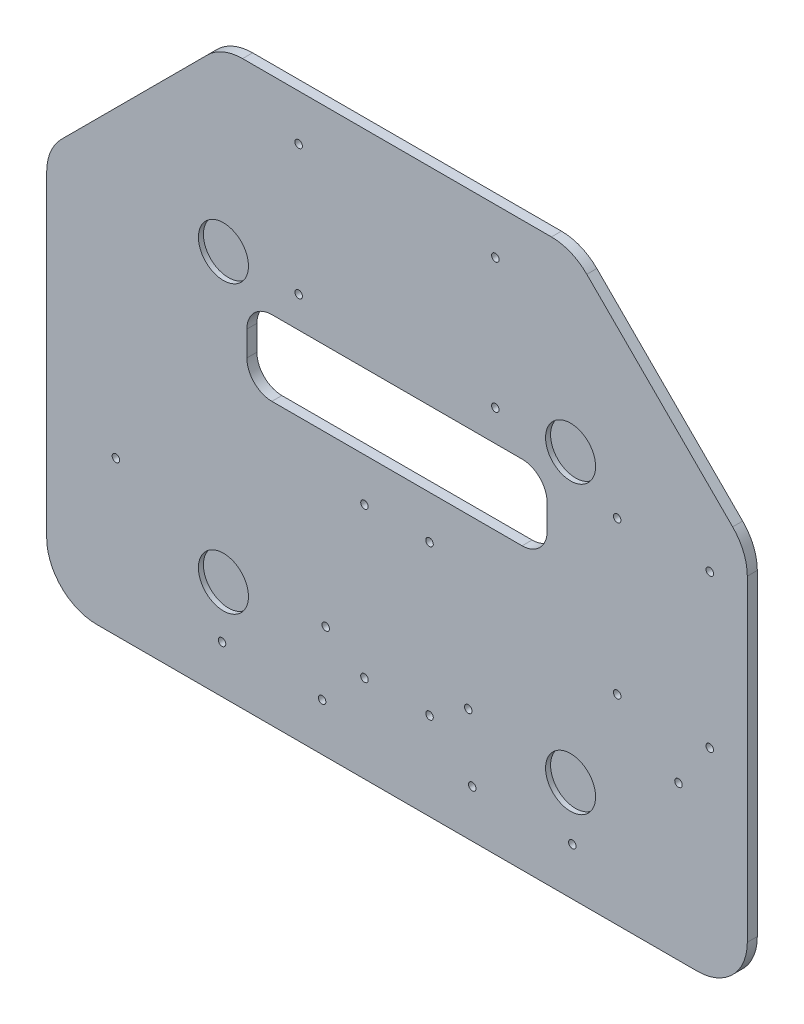
from build123d import *

# Parameters (mm, degrees)
EXTRUDE_1_DEPTH      = 4
SKETCH_6_R           = 1.5
CUT_EXTRUDE_3_DEPTH  = 4
SKETCH_4_R           = 1.5
CUT_EXTRUDE_4_DEPTH  = 4
SKETCH_7_R           = 1.5
CUT_EXTRUDE_5_DEPTH  = 4
SKETCH_8_R           = 1.5
CUT_EXTRUDE_6_DEPTH  = 4
CUT_EXTRUDE_7_DEPTH  = 4
SKETCH_10_R          = 1.5
CUT_EXTRUDE_9_DEPTH  = 4
SKETCH_11_R          = 10
CUT_EXTRUDE_10_DEPTH = 2


with BuildPart() as part:
    # 草图3 → 凸台-拉伸1 (new body)
    with BuildSketch(Plane.XY):
        with BuildLine():
            Line((73.505746565, 259.089488009), (196.937204075, 259.089488009))
            ThreePointArc((196.937204075, 259.089488009), (204.590872722, 257.56707866), (211.079339699, 253.231623633))
            Line((211.079339699, 253.231623633), (269.363610944, 194.947352388))
            ThreePointArc((269.363610944, 194.947352388), (273.69906597, 188.458885412), (275.22147532, 180.805216764))
            Line((275.22147532, 180.805216764), (275.22147532, 54.089488009))
            ThreePointArc((275.22147532, 54.089488009), (269.363610944, 39.947352386), (255.22147532, 34.089488009))
            Line((255.22147532, 34.089488009), (15.221475318, 34.089488009))
            ThreePointArc((15.221475318, 34.089488009), (1.079339694, 39.947352386), (-4.778524682, 54.089488009))
            Line((-4.778524682, 54.089488009), (-4.778524682, 180.805216762))
            ThreePointArc((-4.778524682, 180.805216762), (-3.256115333, 188.458885409), (1.079339694, 194.947352386))
            Line((1.079339694, 194.947352386), (59.363610941, 253.231623633))
            ThreePointArc((59.363610941, 253.231623633), (65.852077918, 257.56707866), (73.505746565, 259.089488009))
        make_face()
    extrude(amount=EXTRUDE_1_DEPTH)

    # 草图6 → 切除-拉伸3 (cut)
    with BuildSketch(Plane.XY.offset(4)):
        with Locations((223.22147532, 174.880072532)):
            Circle(SKETCH_6_R)
        with Locations((260.22147532, 174.880072532)):
            Circle(SKETCH_6_R)
        with Locations((260.22147532, 113.880072532)):
            Circle(SKETCH_6_R)
        with Locations((223.22147532, 113.880072532)):
            Circle(SKETCH_6_R)
    extrude(amount=-CUT_EXTRUDE_3_DEPTH, mode=Mode.SUBTRACT)

    # 草图4 → 切除-拉伸4 (cut)
    with BuildSketch(Plane.XY.offset(4)):
        with Locations((95.92147532, 240.74535793)):
            Circle(SKETCH_4_R)
        with Locations((174.52147532, 240.74535793)):
            Circle(SKETCH_4_R)
        with Locations((174.52147532, 188.74535793)):
            Circle(SKETCH_4_R)
        with Locations((95.92147532, 188.74535793)):
            Circle(SKETCH_4_R)
        with Locations((105.293657462, 53.06830954)):
            Circle(SKETCH_4_R)
        with Locations((165.293657462, 53.06830954)):
            Circle(SKETCH_4_R)
    extrude(amount=-CUT_EXTRUDE_4_DEPTH, mode=Mode.SUBTRACT)

    # 草图7 → 切除-拉伸5 (cut)
    with BuildSketch(Plane.XY.offset(4)):
        with Locations((122.221475319, 129.089488009)):
            Circle(SKETCH_7_R)
        with Locations((148.221475319, 129.089488009)):
            Circle(SKETCH_7_R)
        with Locations((122.221475319, 69.089488009)):
            Circle(SKETCH_7_R)
        with Locations((148.221475319, 69.089488009)):
            Circle(SKETCH_7_R)
    extrude(amount=-CUT_EXTRUDE_5_DEPTH, mode=Mode.SUBTRACT)

    # 草图8 → 切除-拉伸6 (cut)
    with BuildSketch(Plane.XY.offset(4)):
        with Locations((22.867250591, 95.494716411)):
            Circle(SKETCH_8_R)
        with Locations((65.293657462, 53.06830954)):
            Circle(SKETCH_8_R)
        with Locations((247.720064334, 95.494716411)):
            Circle(SKETCH_8_R)
        with Locations((205.293657462, 53.06830954)):
            Circle(SKETCH_8_R)
    extrude(amount=-CUT_EXTRUDE_6_DEPTH, mode=Mode.SUBTRACT)

    # 草图9 → 切除-拉伸7 (cut)
    with BuildSketch(Plane.XY.offset(4)):
        with BuildLine():
            Line((135.22147532, 176.324698125), (85.22147532, 176.324698125))
            ThreePointArc((85.22147532, 176.324698125), (78.150407508, 173.395765937), (75.22147532, 166.324698125))
            Line((75.22147532, 166.324698125), (75.22147532, 156.324698125))
            ThreePointArc((75.22147532, 156.324698125), (78.150407508, 149.253630313), (85.22147532, 146.324698125))
            Line((85.22147532, 146.324698125), (185.22147532, 146.324698125))
            ThreePointArc((185.22147532, 146.324698125), (192.292543132, 149.253630313), (195.22147532, 156.324698125))
            Line((195.22147532, 156.324698125), (195.22147532, 166.324698125))
            ThreePointArc((195.22147532, 166.324698125), (192.292543132, 173.395765937), (185.22147532, 176.324698125))
            Line((185.22147532, 176.324698125), (135.22147532, 176.324698125))
        make_face()
    extrude(amount=-CUT_EXTRUDE_7_DEPTH, mode=Mode.SUBTRACT)

    # 草图10 → 切除-拉伸9 (cut)
    with BuildSketch(Plane.XY.offset(4)):
        with Locations((106.721475319, 79.089488009)):
            Circle(SKETCH_10_R)
        with Locations((163.721475319, 79.089488009)):
            Circle(SKETCH_10_R)
    extrude(amount=-CUT_EXTRUDE_9_DEPTH, mode=Mode.SUBTRACT)

    # 草图11 → 切除-拉伸10 (cut)
    with BuildSketch(Plane.XY.offset(4)):
        with Locations((204.590872722, 74.089488009)):
            Circle(SKETCH_11_R)
        with Locations((65.852077918, 74.089488009)):
            Circle(SKETCH_11_R)
        with Locations((65.852077918, 188.458885409)):
            Circle(SKETCH_11_R)
        with Locations((204.590872722, 188.458885409)):
            Circle(SKETCH_11_R)
    extrude(amount=-CUT_EXTRUDE_10_DEPTH, mode=Mode.SUBTRACT)


solid = part.part
